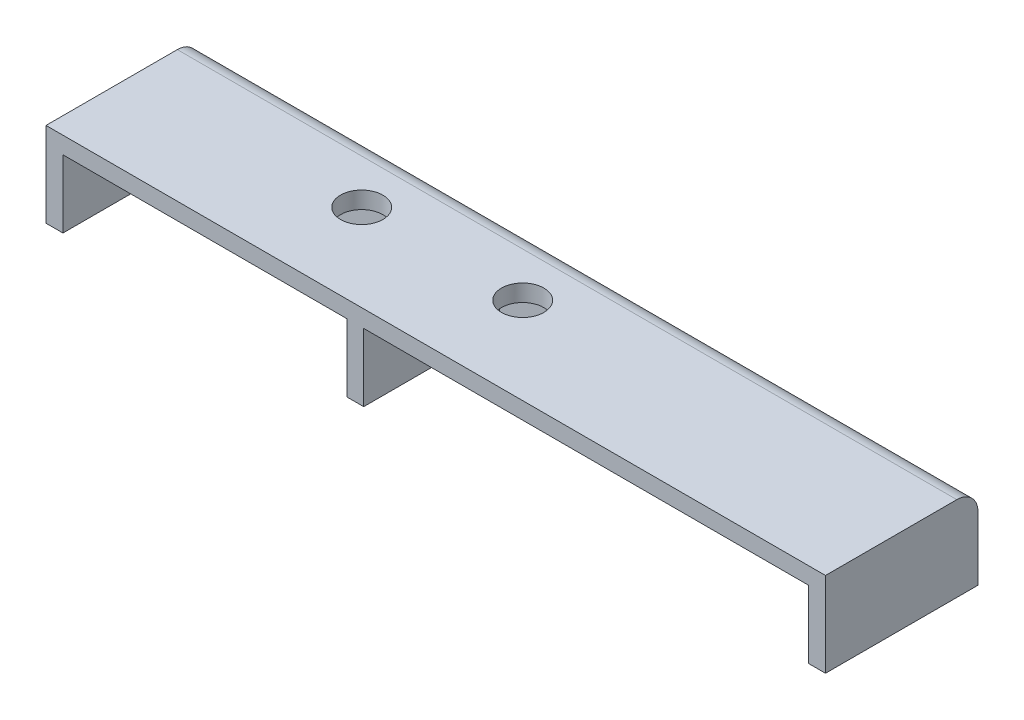
from build123d import *

# Parameters (mm, degrees)
SKETCH1_W                    = 92
SKETCH1_H                    = 18
BASE_FLANGE1_DEPTH           = 2
SKETCH11_R                   = 2.5
CUT_EXTRUDE1_DEPTH           = 2
EDGE_FLANGE1_STRIP_W         = 9
EDGE_FLANGE1_STRIP_H         = 2
EDGE_FLANGE1_STRIP_CUT_DEPTH = 92
EDGE_FLANGE1_DEPTH           = 92
BOSS_EXTRUDE2_DEPTH          = 2
LPATTERN1_COUNT              = 2
LPATTERN1_PITCH              = 35.5


# Sheet-metal steps are written as plain solids
with BuildPart() as part:
    # Sketch1 → Base-Flange1 (new body)
    with BuildSketch(Plane(origin=(0, 0, 0), x_dir=(1, 0, 0), z_dir=(0, 1, 0))):
        with Locations((0, 9)):
            Rectangle(SKETCH1_W, SKETCH1_H)
    extrude(amount=-BASE_FLANGE1_DEPTH)

    # Sketch11 → Cut-Extrude1 (cut)
    with BuildSketch(Plane(origin=(0, 0, 0), x_dir=(1, 0, 0), z_dir=(0, 1, 0))):
        with Locations(Location((0, 10.26, 0), (0, 0, 270))):
            Circle(SKETCH11_R)
        with Locations(Location((-19, 10.26, 0), (0, 0, 270))):
            Circle(SKETCH11_R)
    extrude(amount=-CUT_EXTRUDE1_DEPTH, mode=Mode.SUBTRACT)

    # Edge-Flange1 strip (across the edge) → Edge-Flange1 strip cut (cut)
    with BuildSketch(Plane(origin=(-46, -2, -18), x_dir=(0, 0, 1), z_dir=(1, 0, 0))):
        with Locations((-2, -1)):
            Rectangle(EDGE_FLANGE1_STRIP_W, EDGE_FLANGE1_STRIP_H)
    extrude(amount=EDGE_FLANGE1_STRIP_CUT_DEPTH, mode=Mode.SUBTRACT)

    # Edge-Flange1 section (across the edge) → Edge-Flange1 (add)
    with BuildSketch(Plane(origin=(-46, -2, -18), x_dir=(0, 0, 1), z_dir=(1, 0, 0))):
        with BuildLine():
            Line((0, 0.5), (0, 8))
            Line((0, 8), (2, 8))
            Line((2, 8), (2, 0.5))
            ThreePointArc((2, 0.5), (2.146446609, 0.146446609), (2.5, 0))
            Line((2.5, 0), (2.5, -2))
            ThreePointArc((2.5, -2), (0.732233047, -1.267766953), (0, 0.5))
        make_face()
    extrude(amount=EDGE_FLANGE1_DEPTH)

    # Sketch18 → Boss-Extrude2 (add)
    with BuildSketch(Plane.ZY.offset(46)):
        with BuildLine():
            Line((0, -2), (-15.5, -2))
            ThreePointArc((-15.5, -2), (-15.853553391, -2.146446609), (-16, -2.5))
            Line((-16, -2.5), (-16, -10))
            Line((-16, -10), (0, -10))
            Line((0, -10), (0, -2))
        make_face()
    boss_extrude2 = extrude(amount=-BOSS_EXTRUDE2_DEPTH)

    # LPattern1: Boss-Extrude2 ×2
    with Locations(*[(i * LPATTERN1_PITCH, 0, 0) for i in range(1, LPATTERN1_COUNT)]):
        add(boss_extrude2)

    # Mirror2: Boss-Extrude2 across plane
    add(boss_extrude2.mirror(Plane(origin=(0, 0, 0), x_dir=(0, 0, 1), z_dir=(1, 0, 0))))


solid = part.part
